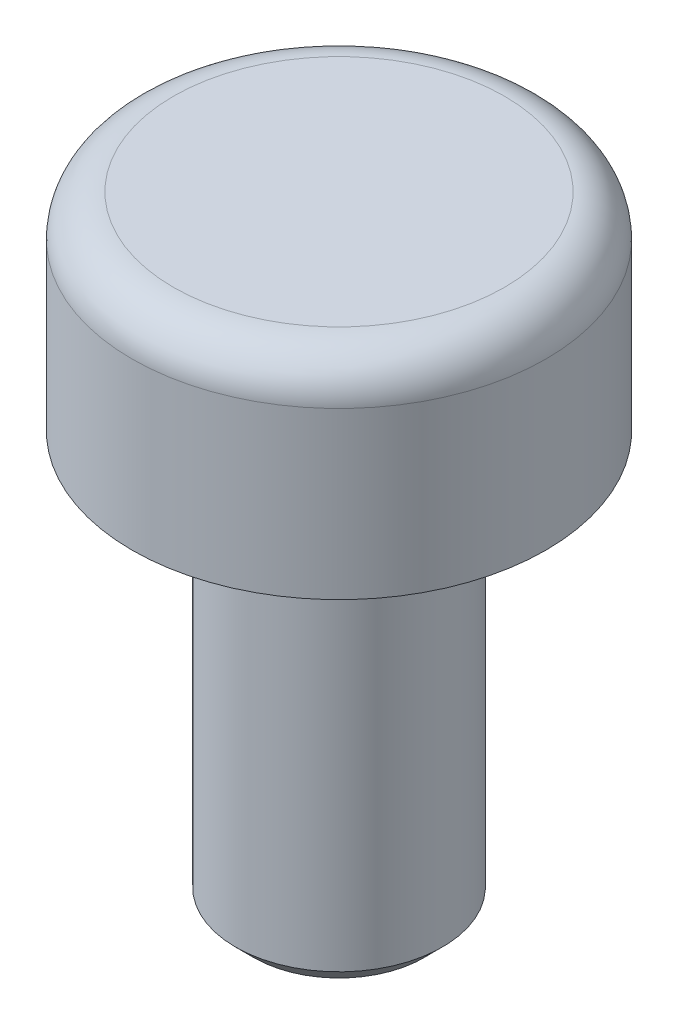
from build123d import *

# Parameters (mm, degrees)
SKETCH1_R           = 3
BOSS_EXTRUDE1_DEPTH = 10
SKETCH2_R           = 5
BOSS_EXTRUDE2_DEPTH = 5
FILLET1_R           = 1


# Read off the part's stored shape, not the designer's step: M5 Machine Threads Stud1
with BuildPart() as part:
    # Sketch1 → Boss-Extrude1 (new body)
    with BuildSketch(Plane(origin=(0, 0, 0), x_dir=(1, 0, 0), z_dir=(0, 1, 0))):
        with Locations(Location((0, 0, 0), (0, 0, 270))):
            Circle(SKETCH1_R)
    extrude(amount=BOSS_EXTRUDE1_DEPTH)

    # Sketch2 → Boss-Extrude2 (add)
    with BuildSketch(Plane(origin=(0, 10, 0), x_dir=(1, 0, 0), z_dir=(0, 1, 0))):
        with Locations(Location((0, 0, 0), (0, 0, 270))):
            Circle(SKETCH2_R)
    extrude(amount=BOSS_EXTRUDE2_DEPTH)

    # Fillet1
    fillet1_edges = [part.edges().sort_by_distance(p)[0] for p in [
        (0, 15, -5),
    ]]
    fillet(fillet1_edges, radius=FILLET1_R)

    # M5 Machine Threads Stud1 outline → M5 Machine Threads Stud1 (revolve, cut)
    with BuildSketch(Plane.XY):
        Polygon((3, 10), (2.5, 10), (2.5, 0.445), (2.055, 0), (3, 0), align=None)
    revolve(axis=Axis((0, 0, 0), (0, 1, 0)), mode=Mode.SUBTRACT)


solid = part.part
